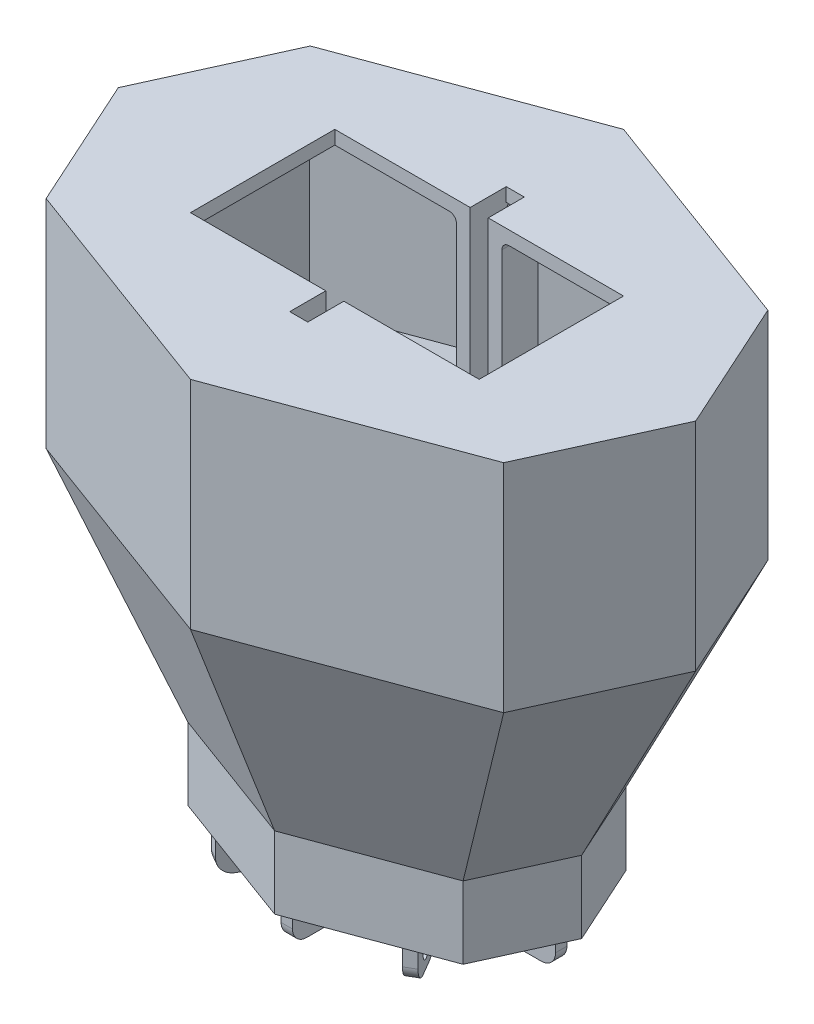
from build123d import *

# Parameters (mm, degrees)
BOSS_EXTRUDE1_DEPTH     = 38.1
CUT_EXTRUDE2_DEPTH      = 35.699999974
BOSS_EXTRUDE2_DEPTH     = 10.3
BOSS_EXTRUDE3_DEPTH     = 2.4
CUT_EXTRUDE3_DEPTH      = 2.400000026
SKETCH15_W              = 2.4
SKETCH15_H              = 6.35
BOSS_EXTRUDE4_DEPTH     = 50.8
SKETCH17_W              = 2.4
SKETCH17_H              = 6.35
FILLET1_R               = 1.27
SKETCH22_W              = 8
SKETCH22_H              = 2
BOSS_EXTRUDE6_DEPTH     = 6
CUT_EXTRUDE4_REACH      = 116.523
SKETCH23_R              = 1.5
FILLET2_R               = 2.54
CRVPATTERN1_START       = -1
CRVPATTERN1_OUTLINE_R   = 1.5
CRVPATTERN1_DEPTH       = 2
CRVPATTERN1_START_2     = -8.351942283
CRVPATTERN1_2_OUTLINE_R = 1.5
CRVPATTERN1_2_DEPTH     = 2
CRVPATTERN1_START_3     = 5.275828871
CRVPATTERN1_3_OUTLINE_R = 1.5
CRVPATTERN1_3_DEPTH     = 2
CRVPATTERN1_START_4     = -1.623155819
CRVPATTERN1_4_OUTLINE_R = 1.5
CRVPATTERN1_4_DEPTH     = 2
CRVPATTERN1_5_OUTLINE_R = 1.5
CRVPATTERN1_5_DEPTH     = 2
CRVPATTERN1_6_OUTLINE_R = 1.5
CRVPATTERN1_6_DEPTH     = 2


with BuildPart() as part:
    # Sketch1 → Boss-Extrude1 (new body)
    with BuildSketch(Plane(origin=(0, 0, 0), x_dir=(1, 0, 0), z_dir=(0, 1, 0))):
        Polygon((-40.254215437, 23.240782119), (-50.8, 0), (-40.254215437, -23.240782119), (0, -38.1), (40.254215437, -23.240782119), (50.8, 0), (40.254215437, 23.240782119), (0, 38.1), align=None)
    extrude(amount=-BOSS_EXTRUDE1_DEPTH)

    # Sketch4 → Cut-Extrude2 (cut)
    with BuildSketch(Plane(origin=(0, -2.400000026, 0), x_dir=(1, 0, 0), z_dir=(0, 1, 0))):
        Polygon((-38.482844664, 21.336363897), (-48.164476541, 0), (-38.482844664, -21.336363897), (0, -35.541707793), (38.482844664, -21.336363897), (48.164476541, 0), (38.482844664, 21.336363897), (0, 35.541707793), align=None)
    extrude(amount=-CUT_EXTRUDE2_DEPTH, mode=Mode.SUBTRACT)



with BuildPart() as body_2:
    # Sketch6 → Boss-Extrude2 (new body)
    with BuildSketch(Plane(origin=(0, -76.2, 0), x_dir=(-1, 0, 0), z_dir=(0, -1, 0))):
        Polygon((0, 23.290943239), (-24.219684, 14.350623383), (-30.731452053, 0), (-24.219684, -14.350623383), (0, -23.290943239), (24.219684, -14.350623383), (30.731452053, 0), (24.219684, 14.350623383), align=None)
        Polygon((0, 20.732651032), (-22.448313226, 12.446205161), (-28.095928594, 0), (-22.448313226, -12.446205161), (0, -20.732651032), (22.448313226, -12.446205161), (28.095928594, 0), (22.448313226, 12.446205161), align=None, mode=Mode.SUBTRACT)
    extrude(amount=BOSS_EXTRUDE2_DEPTH)


with BuildPart() as part_1:
    add(part.part)

    add(body_2.part)  # Loft2 merges body 2
    # Sketch12 → Loft2 section 0
    with BuildSketch(Plane.XZ.offset(38.1)):
        with BuildLine():
            Line((50.8, 0), (40.254215437, -23.240782119))
            Line((40.254215437, -23.240782119), (0, -38.1))
            Line((0, -38.1), (-40.254215437, -23.240782119))
            Line((-40.254215437, -23.240782119), (-50.8, 0))
            Line((-50.8, 0), (-40.254215437, 23.240782119))
            Line((-40.254215437, 23.240782119), (0, 38.1))
            Line((0, 38.1), (40.254215437, 23.240782119))
            Line((40.254215437, 23.240782119), (50.8, 0))
        make_face()
    # Sketch9 → Loft2 section 1
    with BuildSketch(Plane(origin=(0, -76.2, 0), x_dir=(1, 0, 0), z_dir=(0, 1, 0))):
        with BuildLine():
            Line((0, -23.290943239), (-24.219684, -14.350623383))
            Line((-24.219684, -14.350623383), (-30.731452053, 0))
            Line((-30.731452053, 0), (-24.219684, 14.350623383))
            Line((-24.219684, 14.350623383), (0, 23.290943239))
            Line((0, 23.290943239), (24.219684, 14.350623383))
            Line((24.219684, 14.350623383), (30.731452053, 0))
            Line((30.731452053, 0), (24.219684, -14.350623383))
            Line((24.219684, -14.350623383), (0, -23.290943239))
        make_face()
    loft()

    # Cut-Loft2: read off the stored shape, not the designer's step
    # Cut-Loft2: loft between two sections, ruled curve by curve
    cut_loft2_from = [
        Edge.make_line((0, -38.1, 35.541707793), (-38.482844664, -38.1, 21.336363897)),
        Edge.make_line((38.482844664, -38.1, 21.336363897), (0, -38.1, 35.541707793)),
        Edge.make_line((48.164476541, -38.1, 0), (38.482844664, -38.1, 21.336363897)),
        Edge.make_line((38.482844664, -38.1, -21.336363897), (48.164476541, -38.1, 0)),
        Edge.make_line((0, -38.1, -35.541707793), (38.482844664, -38.1, -21.336363897)),
        Edge.make_line((-38.482844664, -38.1, -21.336363897), (0, -38.1, -35.541707793)),
        Edge.make_line((-48.164476541, -38.1, 0), (-38.482844664, -38.1, -21.336363897)),
        Edge.make_line((-38.482844664, -38.1, 21.336363897), (-48.164476541, -38.1, 0)),
    ]
    cut_loft2_to = [
        Edge.make_line((0, -76.2, 20.732651032), (-22.448313226, -76.2, 12.446205161)),
        Edge.make_line((22.448313226, -76.2, 12.446205161), (0, -76.2, 20.732651032)),
        Edge.make_line((28.095928594, -76.2, 0), (22.448313226, -76.2, 12.446205161)),
        Edge.make_line((22.448313226, -76.2, -12.446205161), (28.095928594, -76.2, 0)),
        Edge.make_line((0, -76.2, -20.732651032), (22.448313226, -76.2, -12.446205161)),
        Edge.make_line((-22.448313226, -76.2, -12.446205161), (0, -76.2, -20.732651032)),
        Edge.make_line((-28.095928594, -76.2, 0), (-22.448313226, -76.2, -12.446205161)),
        Edge.make_line((-22.448313226, -76.2, 12.446205161), (-28.095928594, -76.2, 0)),
    ]
    cut_loft2 = Solid(Shell([*[Face.make_surface_from_curves(cut_loft2_from[k], cut_loft2_to[k]) for k in range(8)], Face(Wire(cut_loft2_from)), Face(Wire(cut_loft2_to))]))
    add(cut_loft2, mode=Mode.SUBTRACT)

    # Sketch13 → Boss-Extrude3 (add)
    with BuildSketch(Plane.XZ.offset(86.5)):
        Polygon((0, -23.290943239), (24.219684, -14.350623383), (30.731452053, 0), (24.219684, 14.350623383), (0, 23.290943239), (-24.219684, 14.350623383), (-30.731452053, 0), (-24.219684, -14.350623383), align=None)
    extrude(amount=BOSS_EXTRUDE3_DEPTH)

    # Sketch14 → Cut-Extrude3 (cut)
    with BuildSketch(Plane(origin=(0, 0, 0), x_dir=(1, 0, 0), z_dir=(0, 1, 0))):
        Polygon((-25.4, -12.7), (-1.5875, -12.7), (-1.5875, -19.05), (1.5875, -19.05), (1.5875, -12.7), (25.4, -12.7), (25.4, 12.7), (1.5875, 12.7), (1.5875, 19.05), (-1.5875, 19.05), (-1.5875, 12.7), (-25.4, 12.7), align=None)
    extrude(amount=-CUT_EXTRUDE3_DEPTH, mode=Mode.SUBTRACT)

    # Sketch15 → Boss-Extrude4 (add)
    with BuildSketch(Plane.XZ.offset(2.400000026)):
        with Locations((-2.7875, 15.875)):
            Rectangle(SKETCH15_W, SKETCH15_H)
        with Locations((2.7875, 15.875)):
            Rectangle(SKETCH15_W, SKETCH15_H)
    boss_extrude4 = extrude(amount=BOSS_EXTRUDE4_DEPTH)

    # Sweep1: sweep along a path in Sketch16
    with BuildLine(Plane(origin=(0, 0, 15.875), x_dir=(-1, 0, 0), z_dir=(0, 0, -1))) as sweep1_path:
        ThreePointArc((2.7875, -53.200000026), (0, -55.987500026), (-2.7875, -53.200000026))
    # Sketch17 → Sweep1 (sweep)
    with BuildSketch(Plane.XZ.offset(53.200000026)):
        with Locations((2.7875, 15.875)):
            Rectangle(SKETCH17_W, SKETCH17_H)
    sweep1 = sweep(path=sweep1_path.line)

    # Mirror1: Boss-Extrude4, Sweep1 across plane
    add(boss_extrude4.mirror(Plane.XY))
    add(sweep1.mirror(Plane.XY))

    # Fillet1
    fillet1_edges = [part_1.edges().sort_by_distance(p)[0] for p in [
        (-2.7875, -2.400000026, 19.05),
        (-3.9875, -2.400000026, 15.875),
        (2.7875, -2.400000026, 19.05),
        (3.9875, -2.400000026, 15.875),
        (-2.7875, -2.400000026, -19.05),
        (-3.9875, -2.400000026, -15.875),
        (2.7875, -2.400000026, -19.05),
        (3.9875, -2.400000026, -15.875),
    ]]
    fillet(fillet1_edges, radius=FILLET1_R)

    # Sketch22 → Boss-Extrude6 (add)
    with BuildSketch(Plane.XZ.offset(88.9)):
        with Locations((-24.381452053, 0)):
            Rectangle(SKETCH22_W, SKETCH22_H)
    extrude(amount=BOSS_EXTRUDE6_DEPTH)

    # Sketch23 → Cut-Extrude4 (cut, up to next)
    with BuildSketch(Plane.XY.offset(1), mode=Mode.PRIVATE) as cut_extrude4_sk1:
        with Locations((-24.381452053, -91.9)):
            Circle(SKETCH23_R)
    cut_extrude4_tool1 = extrude(cut_extrude4_sk1.sketch, amount=-CUT_EXTRUDE4_REACH, mode=Mode.PRIVATE) & part_1.part
    add(cut_extrude4_tool1.solids().sort_by_distance((-24.381452, -91.9, 1))[0], mode=Mode.SUBTRACT)

    # Fillet2
    fillet2_edges = [part_1.edges().sort_by_distance(p)[0] for p in [
        (-28.381452053, -94.9, 0),
        (-20.381452053, -94.9, 0),
    ]]
    fillet(fillet2_edges, radius=FILLET2_R)

    # CrvPattern1: read off the stored shape, not the designer's step
    # CrvPattern1 outline → CrvPattern1 (add)
    with BuildSketch(Plane.XY.offset(CRVPATTERN1_START)):
        with BuildLine():
            ThreePointArc((19.135140415, -92.36), (19.879089191, -94.156051225), (21.675140415, -94.9))
            Line((21.675140415, -94.9), (24.595140415, -94.9))
            ThreePointArc((24.595140415, -94.9), (26.391191639, -94.156051224), (27.135140415, -92.36))
            Line((27.135140415, -92.36), (27.135140415, -88.9))
            Line((27.135140415, -88.9), (19.135140415, -88.9))
            Line((19.135140415, -88.9), (19.135140415, -92.36))
        make_face()
        with Locations((23.135140415, -91.9)):
            Circle(CRVPATTERN1_OUTLINE_R, mode=Mode.SUBTRACT)
    extrude(amount=CRVPATTERN1_DEPTH)

    # CrvPattern1 2 outline → CrvPattern1 2 (add)
    with BuildSketch(Plane(origin=(0, 0, 0), x_dir=(0.504454171814361, 0, 0.8634384682993266), z_dir=(0.8634384682993265, 0, -0.5044541718143614)).offset(CRVPATTERN1_START_2)):
        with BuildLine():
            ThreePointArc((-14.946416582, 92.36), (-15.690365358, 94.156051224), (-17.486416582, 94.9))
            Line((-17.486416582, 94.9), (-20.406416582, 94.9))
            ThreePointArc((-20.406416582, 94.9), (-22.202467806, 94.156051224), (-22.946416582, 92.36))
            Line((-22.946416582, 92.36), (-22.946416582, 88.9))
            Line((-22.946416582, 88.9), (-14.946416582, 88.9))
            Line((-14.946416582, 88.9), (-14.946416582, 92.36))
        make_face()
        with Locations((-18.946416582, 91.9)):
            Circle(CRVPATTERN1_2_OUTLINE_R, mode=Mode.SUBTRACT)
    extrude(amount=CRVPATTERN1_2_DEPTH)

    # CrvPattern1 3 outline → CrvPattern1 3 (add)
    with BuildSketch(Plane(origin=(0, 0, 0), x_dir=(0.504454171814361, 0, 0.8634384682993266), z_dir=(0.8634384682993265, 0, -0.5044541718143614)).offset(CRVPATTERN1_START_3)):
        with BuildLine():
            Line((14.317709477, 92.36), (14.317709477, 88.9))
            Line((14.317709477, 88.9), (22.317709477, 88.9))
            Line((22.317709477, 88.9), (22.317709477, 92.36))
            ThreePointArc((22.317709477, 92.36), (21.573760701, 94.156051224), (19.777709477, 94.9))
            Line((19.777709477, 94.9), (16.857709477, 94.9))
            ThreePointArc((16.857709477, 94.9), (15.061658253, 94.156051225), (14.317709477, 92.36))
        make_face()
        with Locations((18.317709477, 91.9)):
            Circle(CRVPATTERN1_3_OUTLINE_R, mode=Mode.SUBTRACT)
    extrude(amount=CRVPATTERN1_3_DEPTH)

    # CrvPattern1 4 outline → CrvPattern1 4 (add)
    # profile 1 of 2: a face of its own
    with BuildSketch(Plane.YZ.offset(CRVPATTERN1_START_4)):
        with BuildLine():
            ThreePointArc((-92.36, -12.522128441), (-94.156051224, -13.266077217), (-94.9, -15.062128441))
            Line((-94.9, -15.062128441), (-94.9, -17.982128441))
            ThreePointArc((-94.9, -17.982128441), (-94.156051224, -19.778179665), (-92.36, -20.522128441))
            Line((-92.36, -20.522128441), (-88.9, -20.522128441))
            Line((-88.9, -20.522128441), (-88.9, -12.522128441))
            Line((-88.9, -12.522128441), (-92.36, -12.522128441))
        make_face()
        with Locations((-91.9, -16.522128441)):
            Circle(CRVPATTERN1_4_OUTLINE_R, mode=Mode.SUBTRACT)
    # profile 2 of 2: a face of its own
    with BuildSketch(Plane.YZ.offset(CRVPATTERN1_START_4)):
        with BuildLine():
            Line((-92.36, 12.522128441), (-88.9, 12.522128441))
            Line((-88.9, 12.522128441), (-88.9, 20.522128441))
            Line((-88.9, 20.522128441), (-92.36, 20.522128441))
            ThreePointArc((-92.36, 20.522128441), (-94.156051224, 19.778179665), (-94.9, 17.982128441))
            Line((-94.9, 17.982128441), (-94.9, 15.062128441))
            ThreePointArc((-94.9, 15.062128441), (-94.156051224, 13.266077217), (-92.36, 12.522128441))
        make_face()
        with Locations((-91.9, 16.522128441)):
            Circle(CRVPATTERN1_4_OUTLINE_R, mode=Mode.SUBTRACT)
    extrude(amount=CRVPATTERN1_4_DEPTH)

    # CrvPattern1 5 outline → CrvPattern1 5 (add)
    with BuildSketch(Plane(origin=(0, 0, 0), x_dir=(0.5044541718143608, 0, -0.8634384682993267), z_dir=(0.8634384682993267, 0, 0.5044541718143608)).offset(CRVPATTERN1_START_2)):
        with BuildLine():
            Line((-14.946416582, -92.36), (-14.946416582, -88.9))
            Line((-14.946416582, -88.9), (-22.946416582, -88.9))
            Line((-22.946416582, -88.9), (-22.946416582, -92.36))
            ThreePointArc((-22.946416582, -92.36), (-22.202467806, -94.156051224), (-20.406416582, -94.9))
            Line((-20.406416582, -94.9), (-17.486416582, -94.9))
            ThreePointArc((-17.486416582, -94.9), (-15.690365358, -94.156051224), (-14.946416582, -92.36))
        make_face()
        with Locations((-18.946416582, -91.9)):
            Circle(CRVPATTERN1_5_OUTLINE_R, mode=Mode.SUBTRACT)
    extrude(amount=CRVPATTERN1_5_DEPTH)

    # CrvPattern1 6 outline → CrvPattern1 6 (add)
    with BuildSketch(Plane(origin=(0, 0, 0), x_dir=(0.5044541718143608, 0, -0.8634384682993267), z_dir=(0.8634384682993267, 0, 0.5044541718143608)).offset(CRVPATTERN1_START_3)):
        with BuildLine():
            ThreePointArc((14.317709477, -92.36), (15.061658253, -94.156051225), (16.857709477, -94.9))
            Line((16.857709477, -94.9), (19.777709477, -94.9))
            ThreePointArc((19.777709477, -94.9), (21.573760701, -94.156051224), (22.317709477, -92.36))
            Line((22.317709477, -92.36), (22.317709477, -88.9))
            Line((22.317709477, -88.9), (14.317709477, -88.9))
            Line((14.317709477, -88.9), (14.317709477, -92.36))
        make_face()
        with Locations((18.317709477, -91.9)):
            Circle(CRVPATTERN1_6_OUTLINE_R, mode=Mode.SUBTRACT)
    extrude(amount=CRVPATTERN1_6_DEPTH)


solid = part_1.part
